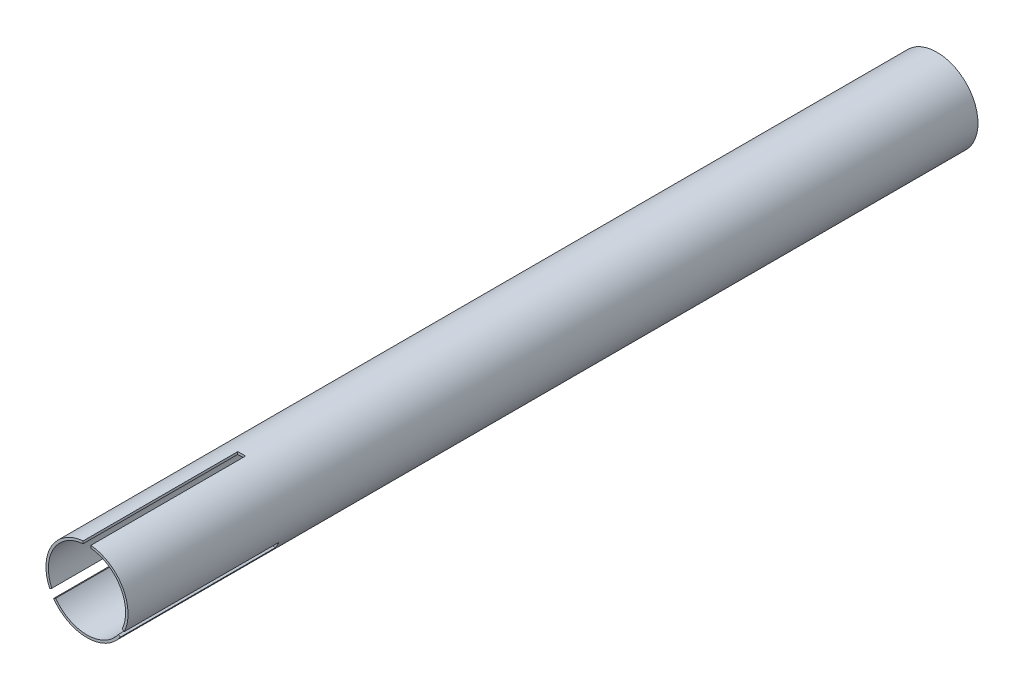
from build123d import *

# Parameters (mm, degrees)
SKETCH1_R           = 26.9875
SKETCH1_R_2         = 25.4
BOSS_EXTRUDE1_DEPTH = 558.8
CUT_EXTRUDE1_REACH  = 562.102
SKETCH2_W           = 5.08
SKETCH2_H           = 101.6
CIRPATTERN1_COUNT   = 3


with BuildPart() as part:
    # Sketch1 → Boss-Extrude1 (new body)
    with BuildSketch(Plane.XY):
        Circle(SKETCH1_R)
        Circle(SKETCH1_R_2, mode=Mode.SUBTRACT)
    extrude(amount=BOSS_EXTRUDE1_DEPTH)

    # Sketch2 → Cut-Extrude1 (cut, up to next)
    with BuildSketch(Plane(origin=(0, 0, 0), x_dir=(1, 0, 0), z_dir=(0, 1, 0)), mode=Mode.PRIVATE) as cut_extrude1_sk1:
        with Locations((0, -508)):
            Rectangle(SKETCH2_W, SKETCH2_H)
    cut_extrude1_tool1 = extrude(cut_extrude1_sk1.sketch, amount=CUT_EXTRUDE1_REACH, mode=Mode.PRIVATE) & part.part
    cut_extrude1 = cut_extrude1_tool1.solids().sort_by_distance((0, 0, 508))[0]
    add(cut_extrude1, mode=Mode.SUBTRACT)

    # CirPattern1: Cut-Extrude1 ×3 about axis
    cirpattern1_axis = Axis((0, 0, -27.94), (0, 0, 1))
    for i in range(1, CIRPATTERN1_COUNT):
        add(cut_extrude1.rotate(cirpattern1_axis, i * 360 / CIRPATTERN1_COUNT), mode=Mode.SUBTRACT)


solid = part.part
